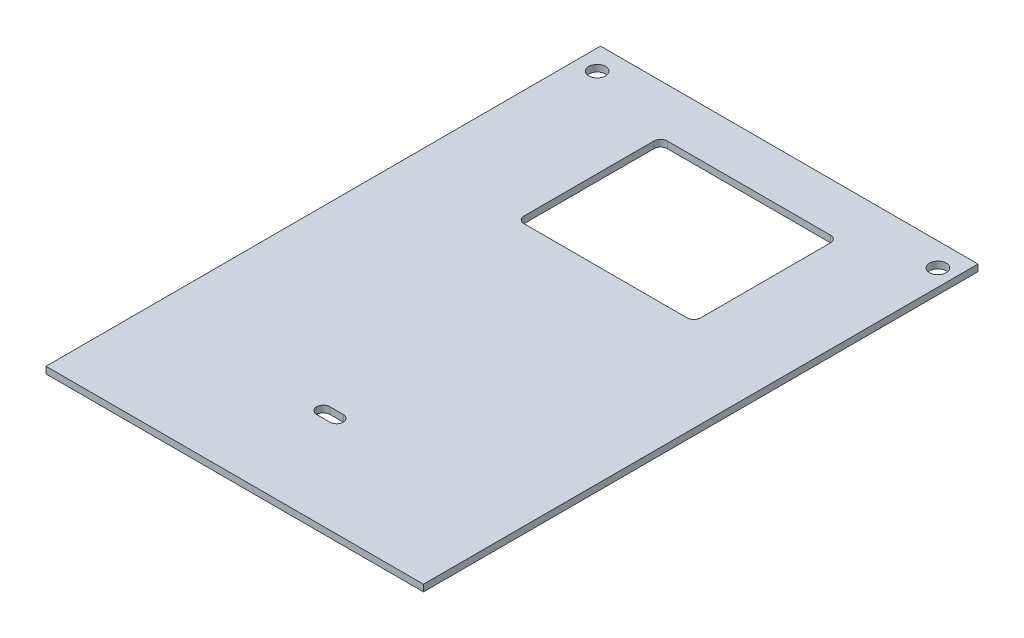
from build123d import *

# Parameters (mm, degrees)
SKETCH1_W           = 113
SKETCH1_H           = 166
BOSS_EXTRUDE1_DEPTH = 2
CUT_EXTRUDE1_REACH  = 102.425
SKETCH2_R           = 2.5
SKETCH2_W           = 8
SKETCH2_H           = 4
FILLET1_R           = 2
SKETCH3_W           = 40
SKETCH3_H           = 5
BOSS_EXTRUDE2_DEPTH = 10
CUT_EXTRUDE2_REACH  = 116.062
SKETCH5_R           = 19
CUT_EXTRUDE3_REACH  = 116.062
SKETCH6_R           = 2
CUT_EXTRUDE4_REACH  = 103.12
SKETCH7_W           = 52.844902502
SKETCH7_H           = 42.914109563
FILLET2_R           = 2


with BuildPart() as part:
    # Sketch1 → Boss-Extrude1 (new body)
    with BuildSketch(Plane(origin=(0, 0, 0), x_dir=(1, 0, 0), z_dir=(0, 1, 0))):
        Rectangle(SKETCH1_W, SKETCH1_H)
    extrude(amount=BOSS_EXTRUDE1_DEPTH)

    # Sketch2 → Cut-Extrude1 (cut, up to next)
    with BuildSketch(Plane(origin=(0, 2, 0), x_dir=(1, 0, 0), z_dir=(0, 1, 0)), mode=Mode.PRIVATE) as cut_extrude1_sk1:
        with Locations(Location((51.5, 76, 0), (0, 0, 270))):
            Circle(SKETCH2_R)
    cut_extrude1_tool1 = extrude(cut_extrude1_sk1.sketch, amount=-CUT_EXTRUDE1_REACH, mode=Mode.PRIVATE) & part.part
    # Sketch2 → Cut-Extrude1 (cut, up to next)
    with BuildSketch(Plane(origin=(0, 2, 0), x_dir=(1, 0, 0), z_dir=(0, 1, 0)), mode=Mode.PRIVATE) as cut_extrude1_sk2:
        with Locations(Location((-50.5, 76, 0), (0, 0, 270))):
            Circle(SKETCH2_R)
    cut_extrude1_tool2 = extrude(cut_extrude1_sk2.sketch, amount=-CUT_EXTRUDE1_REACH, mode=Mode.PRIVATE) & part.part
    # Sketch2 → Cut-Extrude1 (cut, up to next)
    with BuildSketch(Plane(origin=(0, 2, 0), x_dir=(1, 0, 0), z_dir=(0, 1, 0)), mode=Mode.PRIVATE) as cut_extrude1_sk3:
        with Locations((-1.5, -53)):
            Rectangle(SKETCH2_W, SKETCH2_H)
    cut_extrude1_tool3 = extrude(cut_extrude1_sk3.sketch, amount=-CUT_EXTRUDE1_REACH, mode=Mode.PRIVATE) & part.part
    add(cut_extrude1_tool1.solids().sort_by_distance((51.5, 2, -76))[0], mode=Mode.SUBTRACT)
    add(cut_extrude1_tool2.solids().sort_by_distance((-50.5, 2, -76))[0], mode=Mode.SUBTRACT)
    add(cut_extrude1_tool3.solids().sort_by_distance((-1.5, 2, 53))[0], mode=Mode.SUBTRACT)

    # Fillet1
    fillet1_edges = [part.edges().sort_by_distance(p)[0] for p in [
        (-5.5, 1, 55),
        (-5.5, 1, 51),
        (2.5, 1, 55),
        (2.5, 1, 51),
    ]]
    fillet(fillet1_edges, radius=FILLET1_R - 0.0001)  # a hair under: the kernel refuses the full size

    # Sketch3 → Boss-Extrude2 (add)
    with BuildSketch(Plane.XZ):
        with Locations((-8.5, 13.079652709)):
            Rectangle(SKETCH3_W, SKETCH3_H)
    extrude(amount=BOSS_EXTRUDE2_DEPTH)

    # Sketch5 → Cut-Extrude2 (cut, up to next)
    with BuildSketch(Plane.XY.offset(15.579652709), mode=Mode.PRIVATE) as cut_extrude2_sk1:
        with Locations((-8.538915201, -19)):
            Circle(SKETCH5_R)
    cut_extrude2_tool1 = extrude(cut_extrude2_sk1.sketch, amount=-CUT_EXTRUDE2_REACH, mode=Mode.PRIVATE) & part.part
    add(cut_extrude2_tool1.solids().sort_by_distance((-8.538915, -19, 15.579653))[0], mode=Mode.SUBTRACT)

    # Sketch6 → Cut-Extrude3 (cut, up to next)
    with BuildSketch(Plane.XY.offset(15.579652709), mode=Mode.PRIVATE) as cut_extrude3_sk1:
        with Locations((7.5, -4)):
            Circle(SKETCH6_R)
    cut_extrude3_tool1 = extrude(cut_extrude3_sk1.sketch, amount=-CUT_EXTRUDE3_REACH, mode=Mode.PRIVATE) & part.part
    cut_extrude3 = cut_extrude3_tool1.solids().sort_by_distance((7.5, -4, 15.579653))[0]
    add(cut_extrude3, mode=Mode.SUBTRACT)

    # Mirror1: Cut-Extrude3 across plane
    add(cut_extrude3.mirror(Plane(origin=(-8.5, 0, 0), x_dir=(0, 0, 1), z_dir=(1, 0, 0))), mode=Mode.SUBTRACT)

    # Sketch7 → Cut-Extrude4 (cut, up to next)
    with BuildSketch(Plane(origin=(0, 2, 0), x_dir=(1, 0, 0), z_dir=(0, 1, 0)), mode=Mode.PRIVATE) as cut_extrude4_sk1:
        with Locations((2.514142356, 46.957054782)):
            Rectangle(SKETCH7_W, SKETCH7_H)
    cut_extrude4_tool1 = extrude(cut_extrude4_sk1.sketch, amount=-CUT_EXTRUDE4_REACH, mode=Mode.PRIVATE) & part.part
    add(cut_extrude4_tool1.solids().sort_by_distance((2.514142, 2, -46.957055))[0], mode=Mode.SUBTRACT)

    # Fillet2
    fillet2_edges = [part.edges().sort_by_distance(p)[0] for p in [
        (28.936593607, 1, -68.414109563),
        (28.936593607, 1, -25.5),
        (-23.908308895, 1, -25.5),
        (-23.908308895, 1, -68.414109563),
    ]]
    fillet(fillet2_edges, radius=FILLET2_R)


solid = part.part
